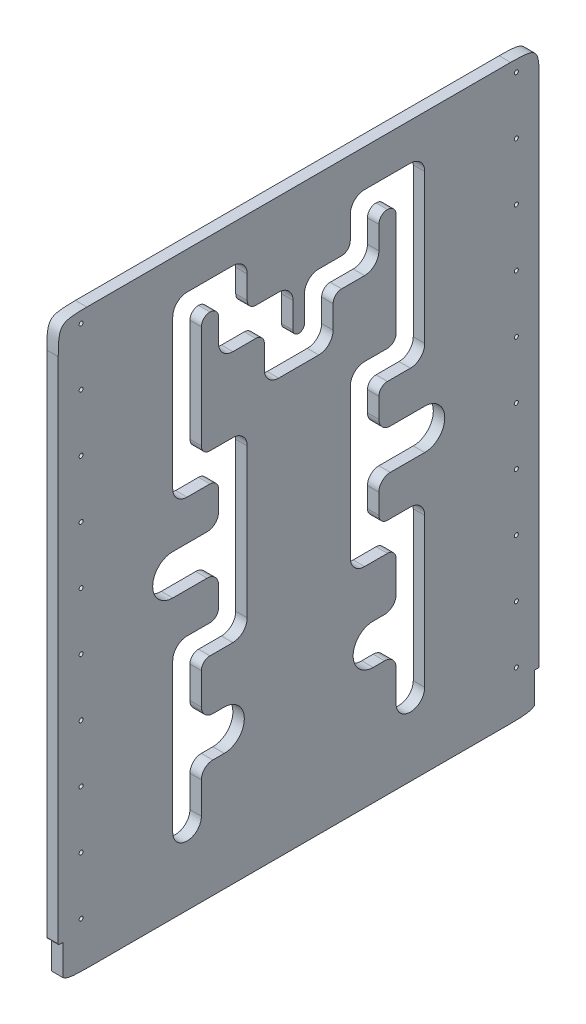
from build123d import *

# Parameters (mm, degrees)
SKETCH_5_W          = 240
SKETCH_5_H          = 480
EXTRUDE_4_DEPTH     = 10
FILLET_1_R          = 7.5
FILLET_2_R          = 5
SKETCH_6_W          = 10
SKETCH_6_H          = 480
EXTRUDE_5_DEPTH     = 90
SKETCH_7_W          = 10
SKETCH_7_H          = 480
EXTRUDE_6_DEPTH     = 90
SKETCH_8_W          = 10
SKETCH_8_H          = 420
EXTRUDE_7_DEPTH     = 20
FILLET_4_SIZE       = 25
SKETCH_9_R          = 1.75
CUT_EXTRUDE_1_DEPTH = 20
SKETCH_10_W         = 4
SKETCH_10_H         = 30
CUT_EXTRUDE_2_DEPTH = 20
FILLET_5_R          = 1
FILLET_6_R          = 1
CUT_EXTRUDE_3_DEPTH = 10
FILLET_7_R          = 10


# Some blends are built 0.0001 mm under size
with BuildPart() as part:
    # 草图5 → 凸台-拉伸4 (new body)
    with BuildSketch(Plane(origin=(0, 0, 0), x_dir=(0, 0, -1), z_dir=(1, 0, 0))):
        Rectangle(SKETCH_5_W, SKETCH_5_H)
        with BuildLine():
            ThreePointArc((-85, -195), (-97.5, -207.5), (-110, -195))
            Line((-110, -195), (-110, -65))
            ThreePointArc((-110, -65), (-106.338834765, -56.161165235), (-97.5, -52.5))
            Line((-97.5, -52.5), (-70, -52.5))
            Line((-70, -52.5), (-70, 52.5))
            Line((-70, 52.5), (-97.5, 52.5))
            ThreePointArc((-97.5, 52.5), (-106.338834765, 56.161165235), (-110, 65))
            Line((-110, 65), (-110, 195))
            ThreePointArc((-110, 195), (-106.338834765, 203.838834765), (-97.5, 207.5))
            Line((-97.5, 207.5), (-57.5, 207.5))
            ThreePointArc((-57.5, 207.5), (-48.661165235, 203.838834765), (-45, 195))
            Line((-45, 195), (-45, 167.5))
            Line((-45, 167.5), (-17.5, 167.5))
            ThreePointArc((-17.5, 167.5), (-8.661165235, 163.838834765), (-5, 155))
            Line((-5, 155), (-5, 127.5))
            Line((-5, 127.5), (5, 127.5))
            Line((5, 127.5), (5, 155))
            ThreePointArc((5, 155), (8.661165235, 163.838834765), (17.5, 167.5))
            Line((17.5, 167.5), (45, 167.5))
            Line((45, 167.5), (45, 195))
            ThreePointArc((45, 195), (48.661165235, 203.838834765), (57.5, 207.5))
            Line((57.5, 207.5), (97.5, 207.5))
            ThreePointArc((97.5, 207.5), (106.338834765, 203.838834765), (110, 195))
            Line((110, 195), (110, 65))
            ThreePointArc((110, 65), (106.338834765, 56.161165235), (97.5, 52.5))
            Line((97.5, 52.5), (70, 52.5))
            Line((70, 52.5), (70, -52.5))
            Line((70, -52.5), (97.5, -52.5))
            ThreePointArc((97.5, -52.5), (106.338834765, -56.161165235), (110, -65))
            Line((110, -65), (110, -195))
            ThreePointArc((110, -195), (97.5, -207.5), (85, -195))
            Line((85, -195), (85, -77.5))
            Line((85, -77.5), (57.5, -77.5))
            ThreePointArc((57.5, -77.5), (48.661165235, -73.838834765), (45, -65))
            Line((45, -65), (45, 65))
            ThreePointArc((45, 65), (48.661165235, 73.838834765), (57.5, 77.5))
            Line((57.5, 77.5), (85, 77.5))
            Line((85, 77.5), (85, 182.5))
            Line((85, 182.5), (70, 182.5))
            Line((70, 182.5), (70, 155))
            ThreePointArc((70, 155), (66.338834765, 146.161165235), (57.5, 142.5))
            Line((57.5, 142.5), (30, 142.5))
            Line((30, 142.5), (30, 115))
            ThreePointArc((30, 115), (26.338834765, 106.161165235), (17.5, 102.5))
            Line((17.5, 102.5), (-17.5, 102.5))
            ThreePointArc((-17.5, 102.5), (-26.338834765, 106.161165235), (-30, 115))
            Line((-30, 115), (-30, 142.5))
            Line((-30, 142.5), (-57.5, 142.5))
            ThreePointArc((-57.5, 142.5), (-66.338834765, 146.161165235), (-70, 155))
            Line((-70, 155), (-70, 182.5))
            Line((-70, 182.5), (-85, 182.5))
            Line((-85, 182.5), (-85, 77.5))
            Line((-85, 77.5), (-57.5, 77.5))
            ThreePointArc((-57.5, 77.5), (-48.661165235, 73.838834765), (-45, 65))
            Line((-45, 65), (-45, -65))
            ThreePointArc((-45, -65), (-48.661165235, -73.838834765), (-57.5, -77.5))
            Line((-57.5, -77.5), (-85, -77.5))
            Line((-85, -77.5), (-85, -195))
        make_face(mode=Mode.SUBTRACT)
    extrude(amount=EXTRUDE_4_DEPTH)

    # 圆角1
    fillet_1_edges = [part.edges().sort_by_distance(p)[0] for p in [
        (5, -77.5, 85),
        (5, -52.5, 70),
        (5, 52.5, 70),
        (5, 77.5, 85),
        (5, 182.5, 85),
        (5, 182.5, 70),
        (5, 167.5, 45),
        (5, 142.5, 30),
        (5, 142.5, -30),
        (5, 167.5, -45),
        (5, 182.5, -70),
        (5, 182.5, -85),
        (5, 77.5, -85),
        (5, 52.5, -70),
        (5, -77.5, -85),
        (5, -52.5, -70),
    ]]
    fillet(fillet_1_edges, radius=FILLET_1_R - 0.0001)  # a hair under: the kernel refuses the full size

    # 圆角2
    fillet_2_edges = [part.edges().sort_by_distance(p)[0] for p in [
        (5, 127.5, 5),
        (5, 127.5, -5),
    ]]
    fillet(fillet_2_edges, radius=FILLET_2_R - 0.0001)  # a hair under: the kernel refuses the full size

    # 草图6 → 凸台-拉伸5 (add)
    with BuildSketch(Plane.XY.offset(120)):
        with Locations((5, 0)):
            Rectangle(SKETCH_6_W, SKETCH_6_H)
    extrude(amount=EXTRUDE_5_DEPTH)

    # 草图7 → 凸台-拉伸6 (add)
    with BuildSketch(Plane(origin=(0, 0, -120), x_dir=(-1, 0, 0), z_dir=(0, 0, -1))):
        with Locations((-5, 0)):
            Rectangle(SKETCH_7_W, SKETCH_7_H)
    extrude(amount=EXTRUDE_6_DEPTH)

    # 草图8 → 凸台-拉伸7 (add)
    with BuildSketch(Plane.XZ.offset(240)):
        with Locations((5, 0)):
            Rectangle(SKETCH_8_W, SKETCH_8_H)
    extrude(amount=EXTRUDE_7_DEPTH)

    # 圆角4
    # a fillet whose section is not a circle: 25 mm, written as the material it takes off along each edge
    with BuildSketch(Plane(origin=(72.5, -260, 210), x_dir=(0, 0, -1), z_dir=(-1, 0, 0)), Plane(origin=(-62.5, 240, -210), x_dir=(0, -1, 0), z_dir=(1, 0, 0)), Plane(origin=(72.5, 240, 210), x_dir=(0, -1, 0), z_dir=(-1, 0, 0))) as fillet_4_piece_1:
        with BuildLine():
            Bezier((FILLET_4_SIZE, 0), (0, 0), (0, -FILLET_4_SIZE), weights=[1, 2.357022604, 1])
            Line((0, -FILLET_4_SIZE), (0, 0))
            Line((0, 0), (FILLET_4_SIZE, 0))
        make_face()
    extrude(amount=135, mode=Mode.SUBTRACT)
    with BuildSketch(Plane(origin=(-62.5, -260, -210), x_dir=(0, 1, 0), z_dir=(1, 0, 0))) as fillet_4_piece_2:
        with BuildLine():
            Bezier((FILLET_4_SIZE, 0), (0, 0), (0, FILLET_4_SIZE), weights=[1, 2.357022604, 1])
            Line((0, FILLET_4_SIZE), (0, 0))
            Line((0, 0), (FILLET_4_SIZE, 0))
        make_face()
    extrude(amount=135, mode=Mode.SUBTRACT)

    # 草图9 → 切除-拉伸1 (cut)
    with BuildSketch(Plane(origin=(10, 0, 0), x_dir=(0, 0, -1), z_dir=(1, 0, 0))):
        with Locations((-190, -220)):
            Circle(SKETCH_9_R)
        with Locations((190, -220)):
            Circle(SKETCH_9_R)
        with Locations((190, -170)):
            Circle(SKETCH_9_R)
        with Locations((190, -120)):
            Circle(SKETCH_9_R)
        with Locations((190, -70)):
            Circle(SKETCH_9_R)
        with Locations((-190, -170)):
            Circle(SKETCH_9_R)
        with Locations((-190, -120)):
            Circle(SKETCH_9_R)
        with Locations((-190, -70)):
            Circle(SKETCH_9_R)
        with Locations((-190, -20)):
            Circle(SKETCH_9_R)
        with Locations((190, -20)):
            Circle(SKETCH_9_R)
        with Locations((-190, 30)):
            Circle(SKETCH_9_R)
        with Locations((190, 30)):
            Circle(SKETCH_9_R)
        with Locations((-190, 80)):
            Circle(SKETCH_9_R)
        with Locations((190, 80)):
            Circle(SKETCH_9_R)
        with Locations((-190, 130)):
            Circle(SKETCH_9_R)
        with Locations((190, 130)):
            Circle(SKETCH_9_R)
        with Locations((-190, 180)):
            Circle(SKETCH_9_R)
        with Locations((190, 180)):
            Circle(SKETCH_9_R)
        with Locations((-190, 230)):
            Circle(SKETCH_9_R)
        with Locations((190, 230)):
            Circle(SKETCH_9_R)
    extrude(amount=-CUT_EXTRUDE_1_DEPTH, mode=Mode.SUBTRACT)

    # 草图10 → 切除-拉伸2 (cut)
    with BuildSketch(Plane(origin=(10, 0, 0), x_dir=(0, 0, -1), z_dir=(1, 0, 0))):
        with Locations((-208, -245)):
            Rectangle(SKETCH_10_W, SKETCH_10_H)
    cut_extrude_2 = extrude(amount=-CUT_EXTRUDE_2_DEPTH, mode=Mode.SUBTRACT)

    # 圆角5
    fillet_5_edges = [part.edges().sort_by_distance(p)[0] for p in [
        (5, -230, 210),
    ]]
    fillet(fillet_5_edges, radius=FILLET_5_R)

    # 镜向2: 切除-拉伸2 across plane
    add(cut_extrude_2.mirror(Plane.XY), mode=Mode.SUBTRACT)

    # 圆角6
    fillet_6_edges = [part.edges().sort_by_distance(p)[0] for p in [
        (5, -230, -210),
    ]]
    fillet(fillet_6_edges, radius=FILLET_6_R)

    # 草图11 → 切除-拉伸3 (cut)
    with BuildSketch(Plane(origin=(10, 0, 0), x_dir=(0, 0, -1), z_dir=(1, 0, 0))):
        with BuildLine():
            Line((-110, -17.5), (-70, -17.5))
            Line((-70, -17.5), (-70, 17.5))
            Line((-70, 17.5), (-110, 17.5))
            ThreePointArc((-110, 17.5), (-127.5, 0), (-110, -17.5))
        make_face()
        with BuildLine():
            Line((110, 17.5), (70, 17.5))
            Line((70, 17.5), (70, -17.5))
            Line((70, -17.5), (110, -17.5))
            ThreePointArc((110, -17.5), (127.5, 0), (110, 17.5))
        make_face()
        with BuildLine():
            Line((85, -157.5), (85, -122.5))
            Line((85, -122.5), (65, -122.5))
            ThreePointArc((65, -122.5), (47.5, -140), (65, -157.5))
            Line((65, -157.5), (85, -157.5))
        make_face()
        with BuildLine():
            Line((-65, -122.5), (-85, -122.5))
            Line((-85, -122.5), (-85, -157.5))
            Line((-85, -157.5), (-65, -157.5))
            ThreePointArc((-65, -157.5), (-47.5, -140), (-65, -122.5))
        make_face()
    extrude(amount=-CUT_EXTRUDE_3_DEPTH, mode=Mode.SUBTRACT)

    # 圆角7
    fillet_7_edges = [part.edges().sort_by_distance(p)[0] for p in [
        (5, -157.5, 85),
        (5, -122.5, 85),
        (5, -122.5, -85),
        (5, -157.5, -85),
        (5, -17.5, -70),
        (5, 17.5, -70),
        (5, 17.5, 70),
        (5, -17.5, 70),
    ]]
    fillet(fillet_7_edges, radius=FILLET_7_R)


solid = part.part
